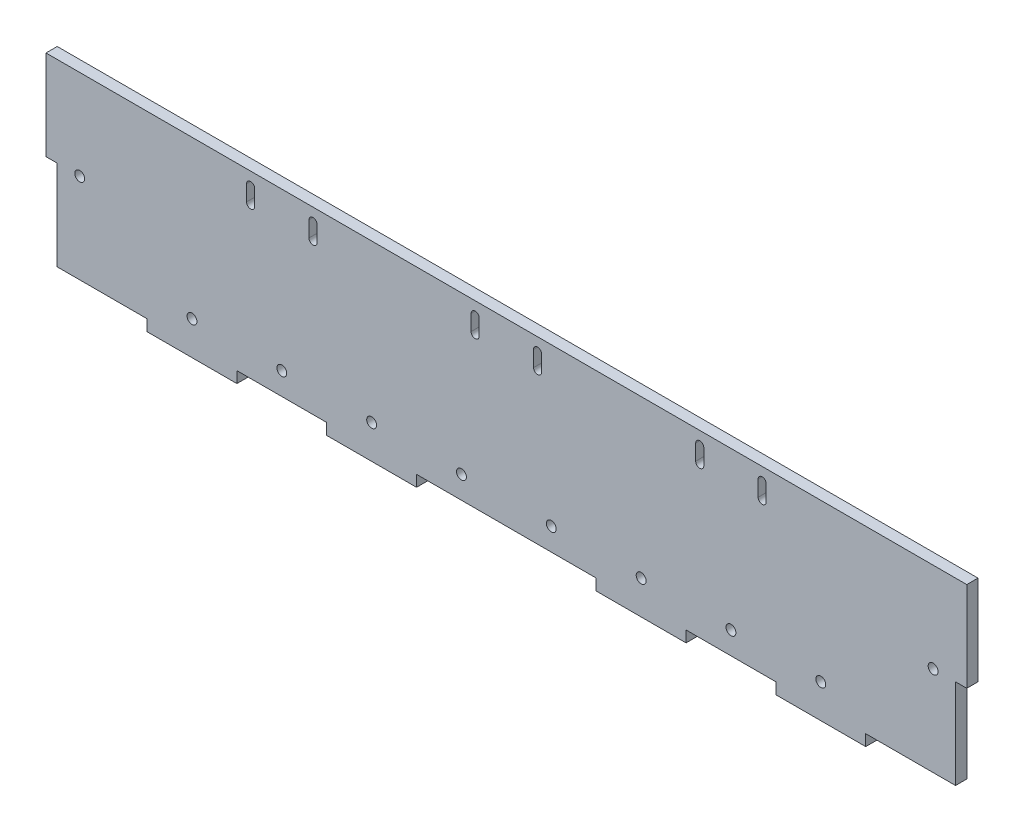
from build123d import *

# Parameters (mm, degrees)
SKETCH_1_R          = 2.2
EXTRUDE_1_DEPTH     = 5
SKETCH_2_W          = 410
SKETCH_2_H          = 226.105378696
CUT_EXTRUDE_2_DEPTH = 5
SKETCH_4_W          = 410
SKETCH_4_H          = 19.486670542
EXTRUDE_3_DEPTH     = 5
CUT_EXTRUDE_3_DEPTH = 10


with BuildPart() as part:
    # 草图1 → 凸台-拉伸1 (new body)
    with BuildSketch(Plane.XY):
        Polygon((200, 150), (-200, 150), (-200, 110), (-205, 110), (-205, 70), (-200, 70), (-200, 30), (-205, 30), (-205, -30), (-200, -30), (-200, -70), (-205, -70), (-205, -110), (-200, -110), (-200, -150), (-160, -150), (-160, -155), (-120, -155), (-120, -150), (-80, -150), (-80, -155), (-40, -155), (-40, -150), (40, -150), (40, -155), (80, -155), (80, -150), (120, -150), (120, -155), (160, -155), (160, -150), (200, -150), (200, -110), (205, -110), (205, -70), (200, -70), (200, -30), (205, -30), (205, 30), (200, 30), (200, 70), (205, 70), (205, 110), (200, 110), align=None)
        with Locations((-140, -140)):
            Circle(SKETCH_1_R, mode=Mode.SUBTRACT)
        with Locations((-190, -110)):
            Circle(SKETCH_1_R, mode=Mode.SUBTRACT)
        with Locations((-100, -140)):
            Circle(SKETCH_1_R, mode=Mode.SUBTRACT)
        with Locations((-60, -140)):
            Circle(SKETCH_1_R, mode=Mode.SUBTRACT)
        with Locations((-20, -140)):
            Circle(SKETCH_1_R, mode=Mode.SUBTRACT)
        with Locations((-190, -70)):
            Circle(SKETCH_1_R, mode=Mode.SUBTRACT)
        with Locations((-190, -30)):
            Circle(SKETCH_1_R, mode=Mode.SUBTRACT)
        with Locations((20, -140)):
            Circle(SKETCH_1_R, mode=Mode.SUBTRACT)
        with Locations((60, -140)):
            Circle(SKETCH_1_R, mode=Mode.SUBTRACT)
        with Locations((100, -140)):
            Circle(SKETCH_1_R, mode=Mode.SUBTRACT)
        with Locations((140, -140)):
            Circle(SKETCH_1_R, mode=Mode.SUBTRACT)
        with Locations((190, -110)):
            Circle(SKETCH_1_R, mode=Mode.SUBTRACT)
        with Locations((190, -70)):
            Circle(SKETCH_1_R, mode=Mode.SUBTRACT)
        with Locations((190, -30)):
            Circle(SKETCH_1_R, mode=Mode.SUBTRACT)
        with Locations((-190, 30)):
            Circle(SKETCH_1_R, mode=Mode.SUBTRACT)
        with Locations((-190, 70)):
            Circle(SKETCH_1_R, mode=Mode.SUBTRACT)
        with Locations((-190, 110)):
            Circle(SKETCH_1_R, mode=Mode.SUBTRACT)
        with Locations((190, 30)):
            Circle(SKETCH_1_R, mode=Mode.SUBTRACT)
        with Locations((190, 70)):
            Circle(SKETCH_1_R, mode=Mode.SUBTRACT)
        with Locations((190, 110)):
            Circle(SKETCH_1_R, mode=Mode.SUBTRACT)
    extrude(amount=EXTRUDE_1_DEPTH)

    # 草图2 → 切除-拉伸2 (cut)
    with BuildSketch(Plane.XY.offset(5)):
        with Locations((0, 43.052689348)):
            Rectangle(SKETCH_2_W, SKETCH_2_H)
    extrude(amount=-CUT_EXTRUDE_2_DEPTH, mode=Mode.SUBTRACT)

    # 草图4 → 凸台-拉伸3 (add)
    with BuildSketch(Plane.XY.offset(5)):
        with Locations((0, -79.743335271)):
            Rectangle(SKETCH_4_W, SKETCH_4_H)
    extrude(amount=-EXTRUDE_3_DEPTH)

    # 草图5 → 切除-拉伸3 (cut)
    with BuildSketch(Plane(origin=(0, 0, 0), x_dir=(-1, 0, 0), z_dir=(0, 0, -1))):
        with BuildLine():
            Line((87.908090335, -75.8), (87.908090335, -82.8))
            ThreePointArc((87.908090335, -82.8), (86.1, -84.608090335), (84.291909665, -82.8))
            Line((84.291909665, -82.8), (84.291909665, -75.8))
            ThreePointArc((84.291909665, -75.8), (86.1, -73.991909665), (87.908090335, -75.8))
        make_face()
        with BuildLine():
            Line((12.091909665, -75.8), (12.091909665, -82.8))
            ThreePointArc((12.091909665, -82.8), (13.9, -84.608090335), (15.708090335, -82.8))
            Line((15.708090335, -82.8), (15.708090335, -75.8))
            ThreePointArc((15.708090335, -75.8), (13.9, -73.991909665), (12.091909665, -75.8))
        make_face()
        with BuildLine():
            Line((-12.091909665, -75.8), (-12.091909665, -82.8))
            ThreePointArc((-12.091909665, -82.8), (-13.9, -84.608090335), (-15.708090335, -82.8))
            Line((-15.708090335, -82.8), (-15.708090335, -75.8))
            ThreePointArc((-15.708090335, -75.8), (-13.9, -73.991909665), (-12.091909665, -75.8))
        make_face()
        with BuildLine():
            Line((112.091909665, -75.8), (112.091909665, -82.8))
            ThreePointArc((112.091909665, -82.8), (113.9, -84.608090335), (115.708090335, -82.8))
            Line((115.708090335, -82.8), (115.708090335, -75.8))
            ThreePointArc((115.708090335, -75.8), (113.9, -73.991909665), (112.091909665, -75.8))
        make_face()
        with BuildLine():
            Line((-87.908090335, -75.8), (-87.908090335, -82.8))
            ThreePointArc((-87.908090335, -82.8), (-86.1, -84.608090335), (-84.291909665, -82.8))
            Line((-84.291909665, -82.8), (-84.291909665, -75.8))
            ThreePointArc((-84.291909665, -75.8), (-86.1, -73.991909665), (-87.908090335, -75.8))
        make_face()
        with BuildLine():
            Line((-112.091909665, -75.8), (-112.091909665, -82.8))
            ThreePointArc((-112.091909665, -82.8), (-113.9, -84.608090335), (-115.708090335, -82.8))
            Line((-115.708090335, -82.8), (-115.708090335, -75.8))
            ThreePointArc((-115.708090335, -75.8), (-113.9, -73.991909665), (-112.091909665, -75.8))
        make_face()
    extrude(amount=-CUT_EXTRUDE_3_DEPTH, mode=Mode.SUBTRACT)


solid = part.part
